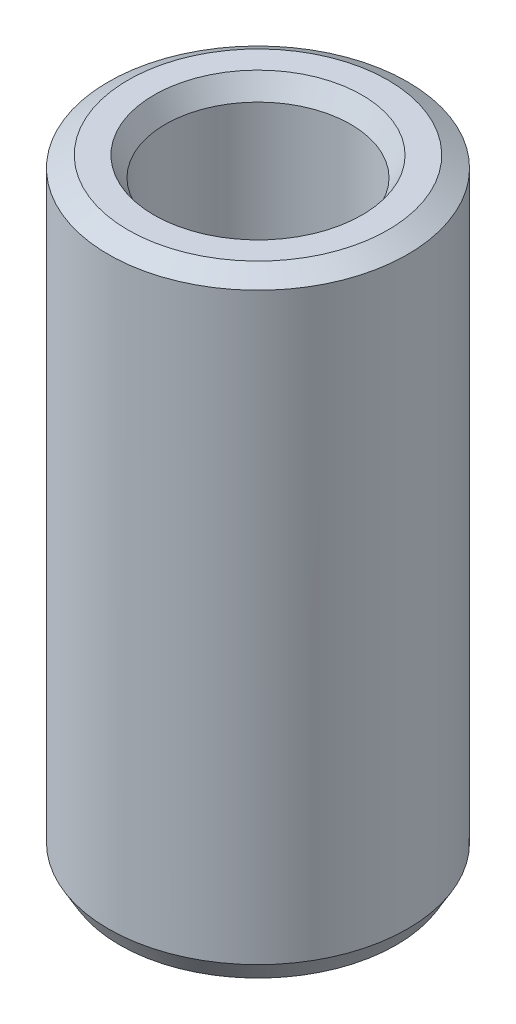
from build123d import *
from OCP.BRepFilletAPI import BRepFilletAPI_MakeChamfer

# Parameters (mm, degrees)
SKETCH1_R           = 47.5
BOSS_EXTRUDE1_DEPTH = 195.296196787
SKETCH2_R           = 29.422918509
CUT_EXTRUDE1_DEPTH  = 207.52628036
CHAMFER1_SIZE       = 3.604198197
CHAMFER1_SIZE2      = 6.242654398


with BuildPart() as part:
    # Sketch1 → Boss-Extrude1 (new body)
    with BuildSketch(Plane(origin=(0, 0, 0), x_dir=(1, 0, 0), z_dir=(0, 1, 0))):
        Circle(SKETCH1_R)
    extrude(amount=BOSS_EXTRUDE1_DEPTH)

    # Sketch2 → Cut-Extrude1 (cut, through all)
    with BuildSketch(Plane(origin=(0, 0, 0), x_dir=(1, 0, 0), z_dir=(0, 1, 0))):
        Circle(SKETCH2_R)
    extrude(amount=CUT_EXTRUDE1_DEPTH, mode=Mode.SUBTRACT)

    # Chamfer1: one chamfer whose edges measure the first distance from different faces: ONE call of the kernel's chamfer builder (chamfer() names one face for all edges)
    chamfer1_edges_1 = [part.edges().sort_by_distance(p)[0] for p in [
        (-29.422918509, 195.296196787, 0),
    ]]
    chamfer1_side_1 = [part.faces().sort_by_distance(p)[0] for p in [
        (-46.156497116, 195.296196787, 0),
    ]]
    chamfer1_edges_2 = [part.edges().sort_by_distance(p)[0] for p in [
        (-29.422918509, 0, 0),
    ]]
    chamfer1_side_2 = [part.faces().sort_by_distance(p)[0] for p in [
        (-29.422918509, 97.648098393, 0),
    ]]
    chamfer1_edges_3 = [part.edges().sort_by_distance(p)[0] for p in [
        (-47.5, 0, 0),
    ]]
    chamfer1_side_3 = [part.faces().sort_by_distance(p)[0] for p in [
        (-46.156497116, 0, 0),
    ]]
    chamfer1_edges_4 = [part.edges().sort_by_distance(p)[0] for p in [
        (-47.5, 195.296196787, 0),
    ]]
    chamfer1_side_4 = [part.faces().sort_by_distance(p)[0] for p in [
        (-47.5, 97.648098393, 0),
    ]]
    chamfer1 = BRepFilletAPI_MakeChamfer(part.part.solid().wrapped)
    for e in chamfer1_edges_1:
        chamfer1.Add(CHAMFER1_SIZE, CHAMFER1_SIZE2, e.wrapped, chamfer1_side_1[0].wrapped)  # the first distance lies on this face
    for e in chamfer1_edges_2:
        chamfer1.Add(CHAMFER1_SIZE, CHAMFER1_SIZE2, e.wrapped, chamfer1_side_2[0].wrapped)  # the first distance lies on this face
    for e in chamfer1_edges_3:
        chamfer1.Add(CHAMFER1_SIZE, CHAMFER1_SIZE2, e.wrapped, chamfer1_side_3[0].wrapped)  # the first distance lies on this face
    for e in chamfer1_edges_4:
        chamfer1.Add(CHAMFER1_SIZE, CHAMFER1_SIZE2, e.wrapped, chamfer1_side_4[0].wrapped)  # the first distance lies on this face
    add(Compound.cast(chamfer1.Shape()), mode=Mode.REPLACE)


solid = part.part
